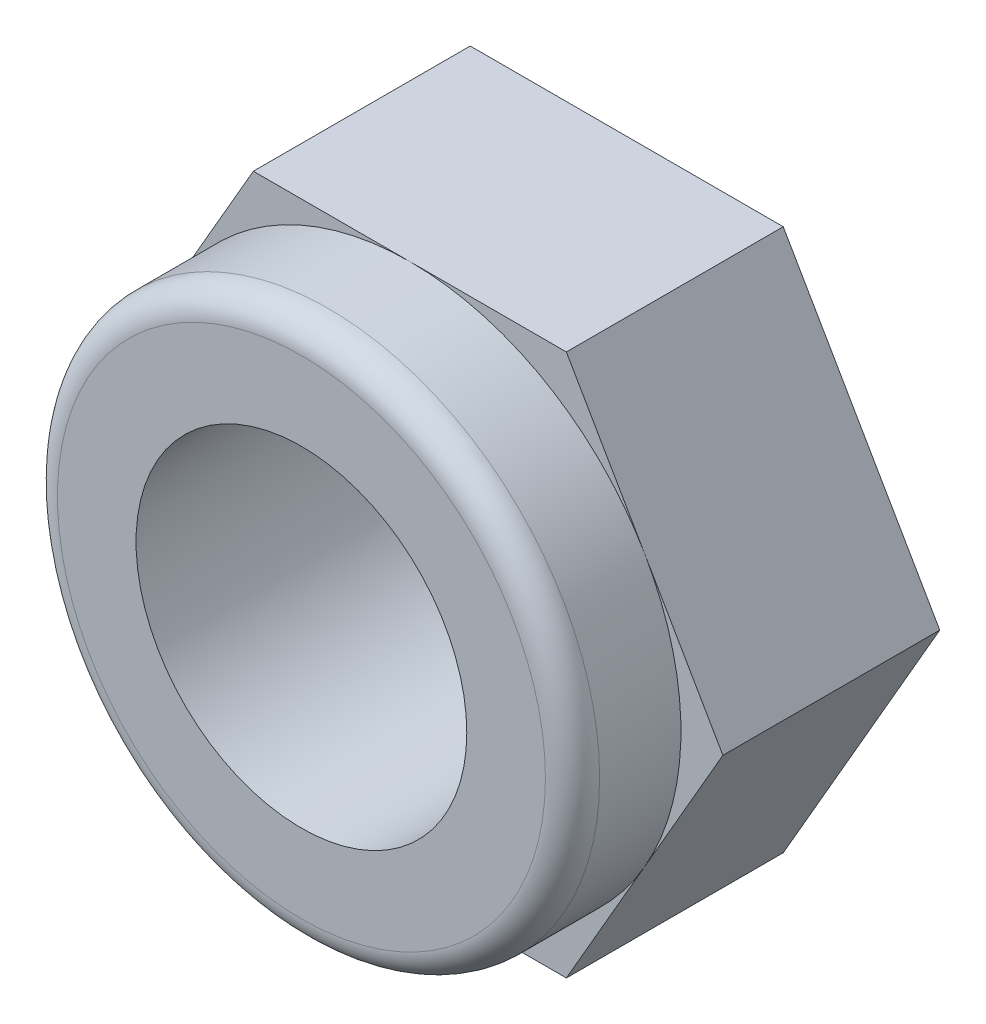
from build123d import *

# Parameters (mm, degrees)
SKETCH1_R           = 3.05
BOSS_EXTRUDE1_DEPTH = 4
SKETCH2_R           = 5
SKETCH2_R_2         = 3.05
BOSS_EXTRUDE2_DEPTH = 2
FILLET1_R           = 0.5


with BuildPart() as part:
    # Sketch1 → Boss-Extrude1 (new body)
    with BuildSketch(Plane.XY):
        Polygon((-2.886751346, -0.1), (-5.773502692, -5.1), (-2.886751346, -10.1), (2.886751346, -10.1), (5.773502692, -5.1), (2.886751346, -0.1), align=None)
        with Locations((0, -5.1)):
            Circle(SKETCH1_R, mode=Mode.SUBTRACT)
    extrude(amount=BOSS_EXTRUDE1_DEPTH)

    # Sketch2 → Boss-Extrude2 (add)
    with BuildSketch(Plane.XY.offset(4)):
        with Locations((0, -5.1)):
            Circle(SKETCH2_R)
        with Locations((0, -5.1)):
            Circle(SKETCH2_R_2, mode=Mode.SUBTRACT)
    extrude(amount=BOSS_EXTRUDE2_DEPTH)

    # Fillet1
    fillet1_edges = [part.edges().sort_by_distance(p)[0] for p in [
        (-5, -5.1, 6),
    ]]
    fillet(fillet1_edges, radius=FILLET1_R)


solid = part.part
